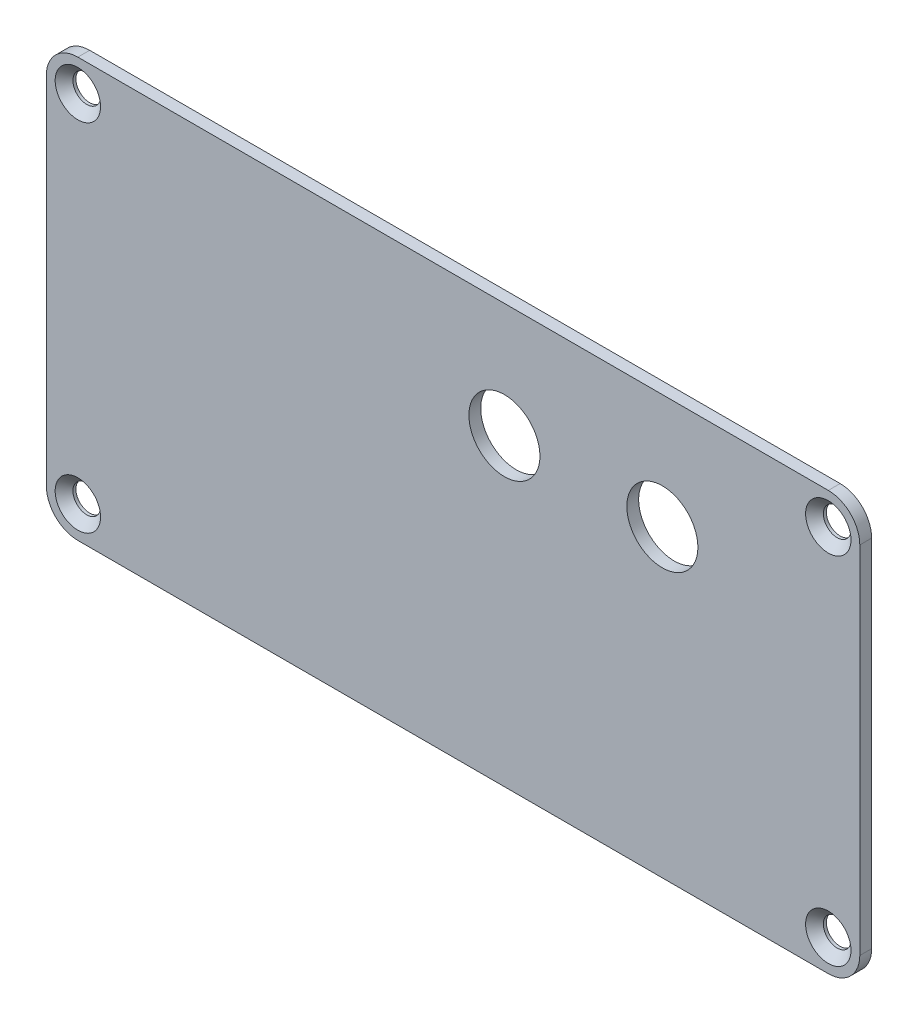
from build123d import *

# Parameters (mm, degrees)
ESQUISSE1_W                                 = 103
ESQUISSE1_H                                 = 53
BOSS_EXTRU_1_DEPTH                          = 1.5
FRAISAGE_POUR_VIS_T_TE_FRAIS_E_M31_AT_COUNT = 2
FRAISAGE_POUR_VIS_T_TE_FRAIS_E_M31_AT_PITCH = 95.02
FRAISAGE_POUR_VIS_T_TE_FRAIS_E_M31_2_COUNT  = 2
FRAISAGE_POUR_VIS_T_TE_FRAIS_E_M31_2_PITCH  = 105.137055314
FRAISAGE_POUR_VIS_T_TE_FRAIS_E_M31_3_COUNT  = 2
FRAISAGE_POUR_VIS_T_TE_FRAIS_E_M31_3_PITCH  = 45
CONG_1_R                                    = 3.99
ESQUISSE4_R                                 = 4.5
ENL_V_MAT_EXTRU_1_DEPTH                     = 58.937466289


with BuildPart() as part:
    # Esquisse1 → Boss.-Extru.1 (new body)
    with BuildSketch(Plane(origin=(0, 0, -0.75), x_dir=(-1, 0, 0), z_dir=(0, 0, -1))):
        Rectangle(ESQUISSE1_W, ESQUISSE1_H)
    extrude(amount=-BOSS_EXTRU_1_DEPTH)

    # Esquisse2 → Fraisage pour vis à tête fraisée M31 (revolve, cut)
    with BuildSketch(Plane(origin=(-47.51, 22.5, 0.75), x_dir=(0, -1, 0), z_dir=(1, 0, 0))):
        Polygon((0, 0), (0, 1.5), (1.75, 1.5), (1.75, 1.125), (2.875, 0), align=None)
    fraisage_pour_vis_t_te_frais_e_m31 = revolve(axis=Axis((-47.51, 22.5, 7.1), (0, 0, -1)), mode=Mode.SUBTRACT)

    # Fraisage pour vis à tête fraisée M31 at: Fraisage pour vis à tête fraisée M31 ×2
    with Locations(*[(i * FRAISAGE_POUR_VIS_T_TE_FRAIS_E_M31_AT_PITCH, 0, 0) for i in range(1, FRAISAGE_POUR_VIS_T_TE_FRAIS_E_M31_AT_COUNT)]):
        add(fraisage_pour_vis_t_te_frais_e_m31, mode=Mode.SUBTRACT)

    # Fraisage pour vis _ t_te frais_e M31 2: Fraisage pour vis à tête fraisée M31 ×2
    with Locations(*[Vector(0.9037726966638099, -0.4280127483674116, 0) * (i * FRAISAGE_POUR_VIS_T_TE_FRAIS_E_M31_2_PITCH) for i in range(1, FRAISAGE_POUR_VIS_T_TE_FRAIS_E_M31_2_COUNT)]):
        add(fraisage_pour_vis_t_te_frais_e_m31, mode=Mode.SUBTRACT)

    # Fraisage pour vis _ t_te frais_e M31 3: Fraisage pour vis à tête fraisée M31 ×2
    with Locations(*[(0, -i * FRAISAGE_POUR_VIS_T_TE_FRAIS_E_M31_3_PITCH, 0) for i in range(1, FRAISAGE_POUR_VIS_T_TE_FRAIS_E_M31_3_COUNT)]):
        add(fraisage_pour_vis_t_te_frais_e_m31, mode=Mode.SUBTRACT)

    # Congé1
    cong_1_edges = [part.edges().sort_by_distance(p)[0] for p in [
        (51.5, 26.5, 0),
        (51.5, -26.5, 0),
        (-51.5, 26.5, 0),
        (-51.5, -26.5, 0),
    ]]
    fillet(cong_1_edges, radius=CONG_1_R)

    # Esquisse4 → Enlèv. mat.-Extru.1 (cut, through all)
    with BuildSketch(Plane.XY.offset(0.75)):
        with Locations((26.5, 12)):
            Circle(ESQUISSE4_R)
        with Locations((6.5, 12)):
            Circle(ESQUISSE4_R)
    extrude(amount=-ENL_V_MAT_EXTRU_1_DEPTH, mode=Mode.SUBTRACT)


solid = part.part
